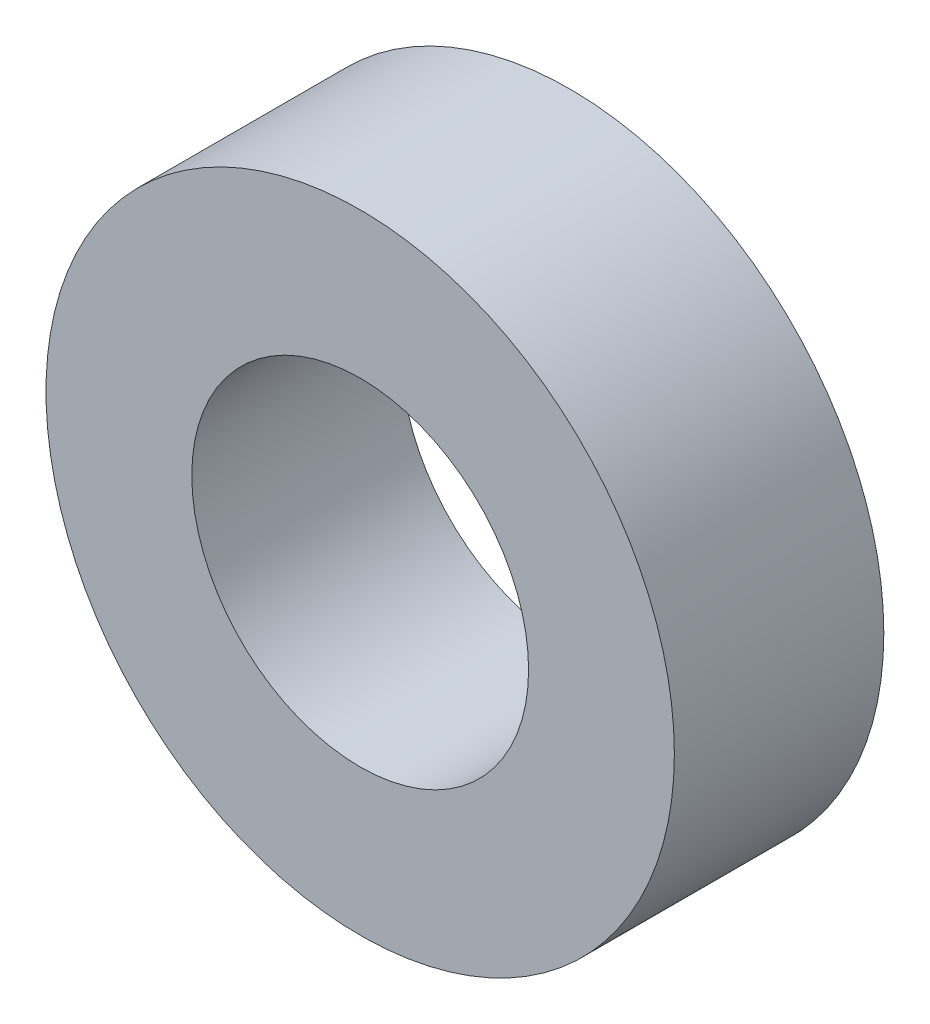
from build123d import *

# Parameters (mm, degrees)
SKETCH1_R           = 4.7625
SKETCH1_R_2         = 2.5527
BOSS_EXTRUDE1_DEPTH = 1.5875


with BuildPart() as part:
    # Sketch1 → Boss-Extrude1 (new, symmetric)
    with BuildSketch(Plane.XY):
        Circle(SKETCH1_R)
        Circle(SKETCH1_R_2, mode=Mode.SUBTRACT)
    extrude(amount=BOSS_EXTRUDE1_DEPTH, both=True)


solid = part.part
